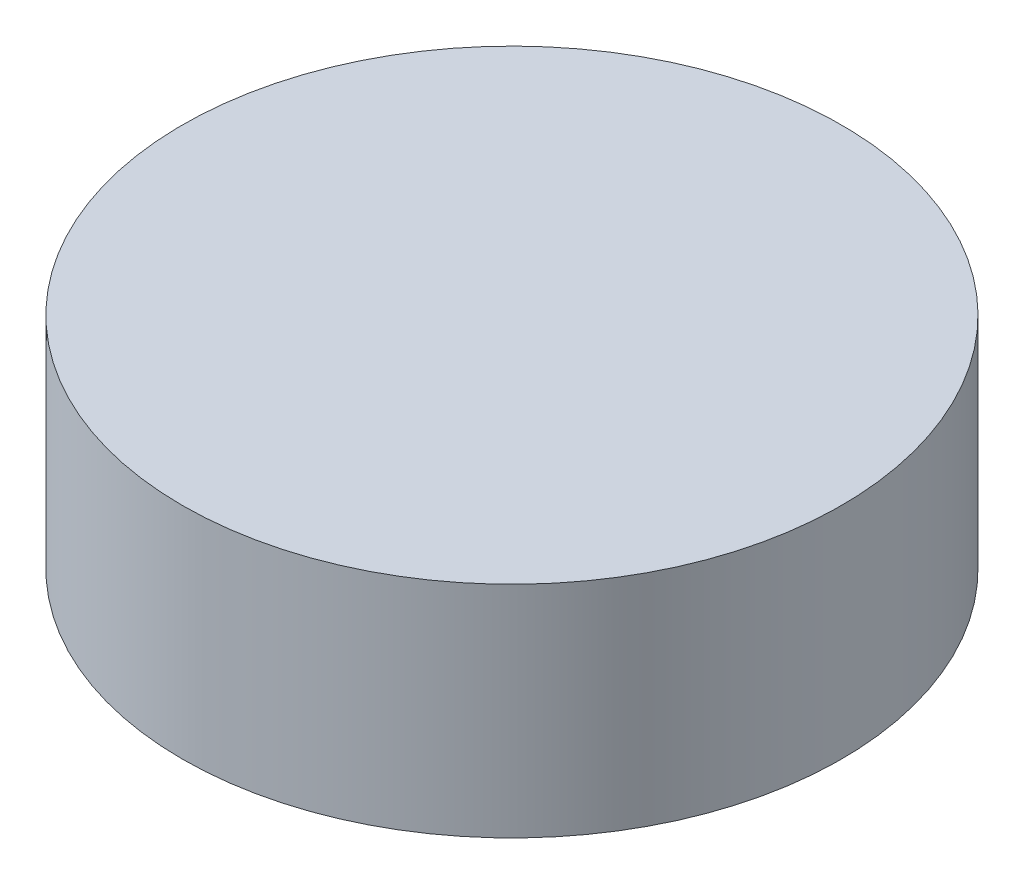
from build123d import *

# Parameters (mm, degrees)
SKETCH_1_R      = 120
EXTRUDE_1_DEPTH = 80


with BuildPart() as part:
    # 草图1 → 凸台-拉伸1 (new body)
    with BuildSketch(Plane(origin=(0, 0, 0), x_dir=(1, 0, 0), z_dir=(0, 1, 0))):
        Circle(SKETCH_1_R)
    extrude(amount=EXTRUDE_1_DEPTH)


solid = part.part
